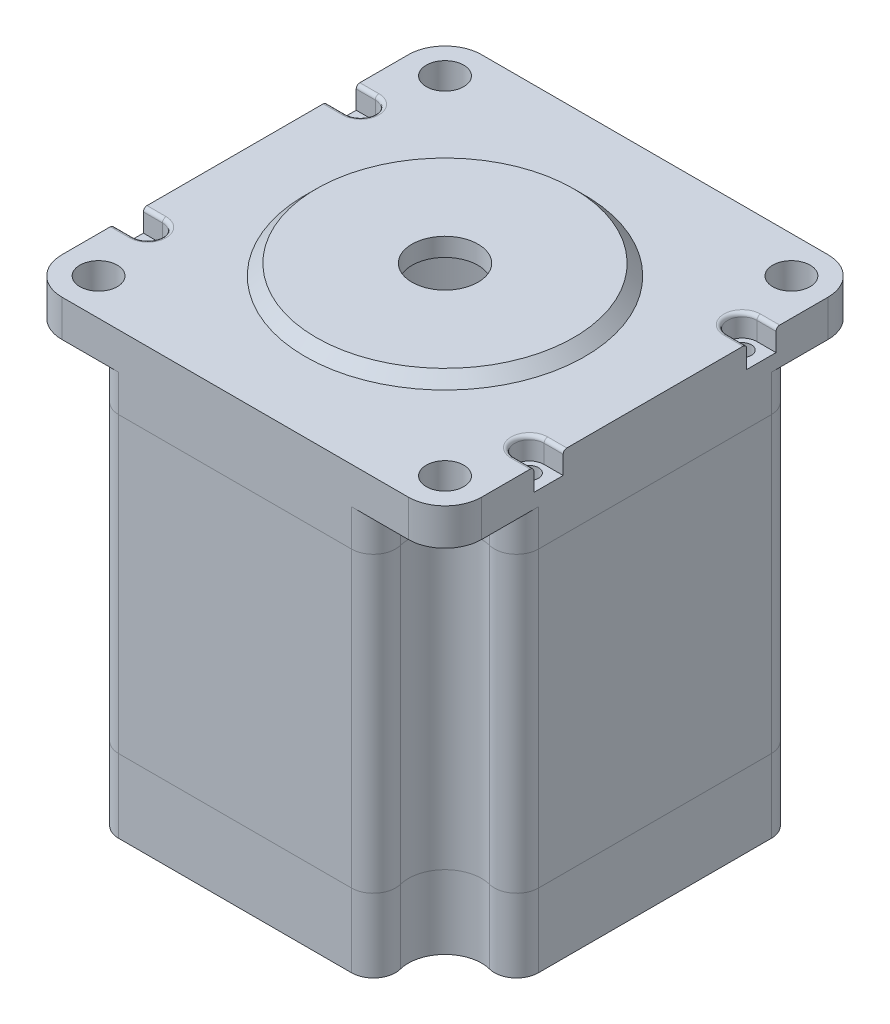
from build123d import *

# Parameters (mm, degrees)
BOSS_EXTRUDE1_DEPTH      = 30
SPLIT1_SURFACE_1_1_BACK  = 101.716
SPLIT1_SURFACE_1_1_DEPTH = 203.432
SPLIT1_SURFACE_1_2_BACK  = 101.716
SPLIT1_SURFACE_1_2_DEPTH = 203.432
SPLIT1_SURFACE_2_3_BACK  = 101.716
SPLIT1_SURFACE_2_3_DEPTH = 203.432
SPLIT1_SURFACE_2_4_BACK  = 101.716
SPLIT1_SURFACE_2_4_DEPTH = 203.432
SKETCH4_R                = 19.05
BOSS_EXTRUDE2_DEPTH      = 1.5
CHAMFER1_SIZE            = 1.5
SKETCH5_R                = 4.5
CUT_EXTRUDE1_DEPTH       = 74.60821964971032
FILLET1_R                = 1.5
CUT_EXTRUDE2_DEPTH       = 55
FILLET2_R                = 3
FILLET3_START            = 19
FILLET3_DEPTH            = 6
FILLET4_R                = 3
MIRROR1_START            = 20
MIRROR1_DEPTH            = 5
MIRROR1_START_2          = -20
MIRROR1_2_DEPTH          = 40
MIRROR1_START_3          = -30
MIRROR1_3_DEPTH          = 10
MIRROR2_START            = 20
MIRROR2_DEPTH            = 5
MIRROR2_START_2          = -20
MIRROR2_2_DEPTH          = 40
MIRROR2_START_3          = -30
MIRROR2_3_DEPTH          = 10
SKETCH7_R                = 2.5499999999999994
CUT_EXTRUDE3_DEPTH       = 73.35965743036655
FILLET5_R                = 5
SKETCH11_R               = 19.05
CUT_EXTRUDE4_DEPTH       = 29
CUT_EXTRUDE6_DEPTH       = 3
FILLET6_R                = 0.5
SKETCH16_R               = 1.2500000000000013
CUT_EXTRUDE8_DEPTH       = 73.35965743036655
CUT_EXTRUDE9_DEPTH       = 5


with BuildPart() as part:
    # Sketch1 → Boss-Extrude1 (new, symmetric)
    with BuildSketch(Plane(origin=(0, 0, 0), x_dir=(1, 0, 0), z_dir=(0, 1, 0))):
        Polygon((28.6, -28.600000000000005), (-28.6, -28.600000000000012), (-28.6, 28.59999999999999), (28.6, 28.599999999999998), align=None)
    extrude(amount=BOSS_EXTRUDE1_DEPTH, both=True)


with BuildPart() as body_2:
    # Split1: the piece behind the surface
    add(part.part)
    # Split1 surface 1: a surface, the sketch's curves swept straight by 203.432 mm
    with BuildLine(Plane(origin=(-3.47e-15, 0, -28.599999999999994), x_dir=(-1, 0, 1.2e-16), z_dir=(-1.2e-16, 0, -1)).offset(-SPLIT1_SURFACE_1_1_BACK), mode=Mode.PRIVATE) as split1_surface_1_1_path:
        Line((-28.600000000000005, 19.999999999999996), (28.599999999999998, 19.999999999999996))
    split1_surface_1_1 = Shell.extrude(split1_surface_1_1_path.wire(), (-1.2e-16 * SPLIT1_SURFACE_1_1_DEPTH, 0 * SPLIT1_SURFACE_1_1_DEPTH, -1 * SPLIT1_SURFACE_1_1_DEPTH))
    split(bisect_by=split1_surface_1_1, keep=Keep.BOTTOM)


with BuildPart() as part_1:
    add(part.part)

    # Split1: split by a surface, the side it looks to stays
    # Split1 surface 1: a surface, the sketch's curves swept straight by 203.432 mm
    with BuildLine(Plane(origin=(-3.47e-15, 0, -28.599999999999994), x_dir=(-1, 0, 1.2e-16), z_dir=(-1.2e-16, 0, -1)).offset(-SPLIT1_SURFACE_1_2_BACK), mode=Mode.PRIVATE) as split1_surface_1_2_path:
        Line((-28.600000000000005, 19.999999999999996), (28.599999999999998, 19.999999999999996))
    split1_surface_1_2 = Shell.extrude(split1_surface_1_2_path.wire(), (-1.2e-16 * SPLIT1_SURFACE_1_2_DEPTH, 0 * SPLIT1_SURFACE_1_2_DEPTH, -1 * SPLIT1_SURFACE_1_2_DEPTH))
    split(bisect_by=split1_surface_1_2, keep=Keep.TOP)

    # Sketch4 → Boss-Extrude2 (add)
    with BuildSketch(Plane(origin=(0, 30, 0), x_dir=(1, 0, 0), z_dir=(0, 1, 0))):
        with Locations(Location((0, 0, 0), (0, 0, 270))):
            Circle(SKETCH4_R)
    extrude(amount=BOSS_EXTRUDE2_DEPTH)

    # Chamfer1
    chamfer1_edges = [part_1.edges().sort_by_distance(p)[0] for p in [
        (5.83e-15, 31.5, -19.05),
    ]]
    chamfer(chamfer1_edges, length=CHAMFER1_SIZE - 0.0001)  # a hair under: the kernel refuses the full size


with BuildPart() as body_3:
    # Split1 2 body 2: the piece behind the surface
    add(body_2.part)
    # Split1 surface 2: a surface, the sketch's curves swept straight by 203.432 mm
    with BuildLine(Plane(origin=(-3.47e-15, 0, -28.599999999999994), x_dir=(-1, 0, 1.2e-16), z_dir=(-1.2e-16, 0, -1)).offset(-SPLIT1_SURFACE_2_3_BACK), mode=Mode.PRIVATE) as split1_surface_2_3_path:
        Line((-28.600000000000005, -19.999999999999996), (28.599999999999998, -19.999999999999996))
    split1_surface_2_3 = Shell.extrude(split1_surface_2_3_path.wire(), (-1.2e-16 * SPLIT1_SURFACE_2_3_DEPTH, 0 * SPLIT1_SURFACE_2_3_DEPTH, -1 * SPLIT1_SURFACE_2_3_DEPTH))
    split(bisect_by=split1_surface_2_3, keep=Keep.BOTTOM)


with BuildPart() as body_2_1:
    add(body_2.part)

    # Split1 2 body 2: split by a surface, the side it looks to stays
    # Split1 surface 2: a surface, the sketch's curves swept straight by 203.432 mm
    with BuildLine(Plane(origin=(-3.47e-15, 0, -28.599999999999994), x_dir=(-1, 0, 1.2e-16), z_dir=(-1.2e-16, 0, -1)).offset(-SPLIT1_SURFACE_2_4_BACK), mode=Mode.PRIVATE) as split1_surface_2_4_path:
        Line((-28.600000000000005, -19.999999999999996), (28.599999999999998, -19.999999999999996))
    split1_surface_2_4 = Shell.extrude(split1_surface_2_4_path.wire(), (-1.2e-16 * SPLIT1_SURFACE_2_4_DEPTH, 0 * SPLIT1_SURFACE_2_4_DEPTH, -1 * SPLIT1_SURFACE_2_4_DEPTH))
    split(bisect_by=split1_surface_2_4, keep=Keep.TOP)


with BuildPart() as cut_extrude1_tool:
    # Sketch5 → Cut-Extrude1 (new, through all)
    with BuildSketch(Plane(origin=(0, 31.5, 0), x_dir=(1, 0, 0), z_dir=(0, 1, 0))):
        with Locations(Location((0, 0, 0), (0, 0, 270))):
            Circle(SKETCH5_R)
    extrude(amount=-CUT_EXTRUDE1_DEPTH)


with BuildPart() as part_2:
    add(part_1.part)

    # Cut-Extrude1: cut by cut_extrude1_tool
    add(cut_extrude1_tool.part, mode=Mode.SUBTRACT)


with BuildPart() as body_2_2:
    add(body_2_1.part)

    # Cut-Extrude1: cut by cut_extrude1_tool
    add(cut_extrude1_tool.part, mode=Mode.SUBTRACT)


with BuildPart() as body_3_1:
    add(body_3.part)

    # Cut-Extrude1: cut by cut_extrude1_tool
    add(cut_extrude1_tool.part, mode=Mode.SUBTRACT)

    # Fillet1
    fillet1_edges = [body_3_1.edges().sort_by_distance(p)[0] for p in [
        (1.38e-15, -30, -4.5),
    ]]
    fillet(fillet1_edges, radius=FILLET1_R)


with BuildPart() as cut_extrude2_tool:
    # Sketch6 → Cut-Extrude2 (new body)
    with BuildSketch(Plane.XZ.offset(30)):
        with BuildLine():
            ThreePointArc((28.6, -23.599999999999994), (20.064466094067267, -20.064466094067242), (23.599999999999998, -28.599999999999984))
            Line((23.6, -28.599999999999998), (28.6, -28.599999999999998))
            Line((28.6, -28.599999999999998), (28.6, -23.599999999999994))
        make_face()
    extrude(amount=-CUT_EXTRUDE2_DEPTH)


with BuildPart() as part_3:
    add(part_2.part)

    # Cut-Extrude2: cut by cut_extrude2_tool
    add(cut_extrude2_tool.part, mode=Mode.SUBTRACT)

    # Fillet3: read off the stored shape, not the designer's step
    # Fillet3 outline → Fillet3 (cut)
    with BuildSketch(Plane(origin=(0, 0, 0), x_dir=(1, 0, 0), z_dir=(0, 1, 0)).offset(FILLET3_START)):
        with BuildLine():
            ThreePointArc((28.6, 23.6), (27.552847075, 20.538137821), (24.85, 18.758770817))
            ThreePointArc((24.85, 18.758770817), (27.437117307, 18.225741553), (28.6, 15.854033308))
            Line((28.6, 15.854033308), (28.6, 23.6))
        make_face()
        with BuildLine():
            ThreePointArc((15.854033308, 28.6), (18.225741553, 27.437117307), (18.758770817, 24.85))
            ThreePointArc((18.758770817, 24.85), (20.538137821, 27.552847075), (23.6, 28.6))
            Line((23.6, 28.6), (15.854033308, 28.6))
        make_face()
    extrude(amount=FILLET3_DEPTH, mode=Mode.SUBTRACT)

    # Mirror1: read off the stored shape, not the designer's step
    # Mirror1 outline → Mirror1 (cut)
    with BuildSketch(Plane(origin=(0, 0, 0), x_dir=(1, 0, 0), z_dir=(0, 1, 0)).offset(MIRROR1_START)):
        with BuildLine():
            Line((-28.6, 28.6), (-28.6, 15.854033308))
            ThreePointArc((-28.6, 15.854033308), (-27.437117307, 18.225741553), (-24.85, 18.758770817))
            ThreePointArc((-24.85, 18.758770817), (-20.064466094, 20.064466094), (-18.758770817, 24.85))
            ThreePointArc((-18.758770817, 24.85), (-18.225741553, 27.437117307), (-15.854033308, 28.6))
            Line((-15.854033308, 28.6), (-28.6, 28.6))
        make_face()
    extrude(amount=MIRROR1_DEPTH, mode=Mode.SUBTRACT)

    # Mirror2: read off the stored shape, not the designer's step
    # Mirror2 outline → Mirror2 (cut)
    with BuildSketch(Plane(origin=(0, 0, 0), x_dir=(1, 0, 0), z_dir=(0, 1, 0)).offset(MIRROR2_START)):
        with BuildLine():
            ThreePointArc((-18.758770817, -24.85), (-20.064466094, -20.064466094), (-24.85, -18.758770817))
            ThreePointArc((-24.85, -18.758770817), (-27.437117307, -18.225741553), (-28.6, -15.854033308))
            Line((-28.6, -15.854033308), (-28.6, -28.6))
            Line((-28.6, -28.6), (-15.854033308, -28.6))
            ThreePointArc((-15.854033308, -28.6), (-18.225741553, -27.437117307), (-18.758770817, -24.85))
        make_face()
        with BuildLine():
            ThreePointArc((18.758770817, -24.85), (18.225741553, -27.437117307), (15.854033308, -28.6))
            Line((15.854033308, -28.6), (28.6, -28.6))
            Line((28.6, -28.6), (28.6, -15.854033308))
            ThreePointArc((28.6, -15.854033308), (27.437117307, -18.225741553), (24.85, -18.758770817))
            ThreePointArc((24.85, -18.758770817), (20.064466094, -20.064466094), (18.758770817, -24.85))
        make_face()
    extrude(amount=MIRROR2_DEPTH, mode=Mode.SUBTRACT)

    # Sketch7 → Cut-Extrude3 (cut, through all)
    with BuildSketch(Plane(origin=(0, 30, 0), x_dir=(1, 0, 0), z_dir=(0, 1, 0))):
        with Locations(Location((-23.6, 23.6, 0), (0, 0, 270))):
            Circle(SKETCH7_R)
        with Locations(Location((23.6, 23.6, 0), (0, 0, 270))):
            Circle(SKETCH7_R)
        with Locations(Location((23.6, -23.60000000000001, 0), (0, 0, 270))):
            Circle(SKETCH7_R)
        with Locations(Location((-23.60000000000001, -23.599999999999994, 0), (0, 0, 270))):
            Circle(SKETCH7_R)
    extrude(amount=-CUT_EXTRUDE3_DEPTH, mode=Mode.SUBTRACT)

    # Fillet5
    fillet5_edges = [part_3.edges().sort_by_distance(p)[0] for p in [
        (-28.6, 27.5, -28.59999999999999),
        (28.6, 27.5, -28.599999999999998),
        (28.6, 27.5, 28.600000000000005),
        (-28.6, 27.5, 28.600000000000012),
    ]]
    fillet(fillet5_edges, radius=FILLET5_R)


with BuildPart() as body_2_3:
    add(body_2_2.part)

    # Cut-Extrude2: cut by cut_extrude2_tool
    add(cut_extrude2_tool.part, mode=Mode.SUBTRACT)

    # Fillet2
    fillet2_edges = [body_2_3.edges().sort_by_distance(p)[0] for p in [
        (23.6, 3.55e-15, -28.59999999999999),
    ]]
    fillet(fillet2_edges, radius=FILLET2_R)
    fillet2_2_edges = [body_2_3.edges().sort_by_distance(p)[0] for p in [
        (28.6, 3.55e-15, -23.599999999999994),
    ]]
    fillet(fillet2_2_edges, radius=FILLET2_R)

    # Mirror1 2 outline → Mirror1 2 (cut)
    with BuildSketch(Plane(origin=(0, 0, 0), x_dir=(1, 0, 0), z_dir=(0, 1, 0)).offset(MIRROR1_START_2)):
        with BuildLine():
            Line((-28.6, 28.6), (-28.6, 15.854033308))
            ThreePointArc((-28.6, 15.854033308), (-27.437117307, 18.225741553), (-24.85, 18.758770817))
            ThreePointArc((-24.85, 18.758770817), (-20.064466094, 20.064466094), (-18.758770817, 24.85))
            ThreePointArc((-18.758770817, 24.85), (-18.225741553, 27.437117307), (-15.854033308, 28.6))
            Line((-15.854033308, 28.6), (-28.6, 28.6))
        make_face()
    extrude(amount=MIRROR1_2_DEPTH, mode=Mode.SUBTRACT)

    # Mirror2 2 outline → Mirror2 2 (cut)
    with BuildSketch(Plane(origin=(0, 0, 0), x_dir=(1, 0, 0), z_dir=(0, 1, 0)).offset(MIRROR2_START_2)):
        with BuildLine():
            ThreePointArc((-18.758770817, -24.85), (-20.064466094, -20.064466094), (-24.85, -18.758770817))
            ThreePointArc((-24.85, -18.758770817), (-27.437117307, -18.225741553), (-28.6, -15.854033308))
            Line((-28.6, -15.854033308), (-28.6, -28.6))
            Line((-28.6, -28.6), (-15.854033308, -28.6))
            ThreePointArc((-15.854033308, -28.6), (-18.225741553, -27.437117307), (-18.758770817, -24.85))
        make_face()
        with BuildLine():
            ThreePointArc((18.758770817, -24.85), (18.225741553, -27.437117307), (15.854033308, -28.6))
            Line((15.854033308, -28.6), (28.6, -28.6))
            Line((28.6, -28.6), (28.6, -15.854033308))
            ThreePointArc((28.6, -15.854033308), (27.437117307, -18.225741553), (24.85, -18.758770817))
            ThreePointArc((24.85, -18.758770817), (20.064466094, -20.064466094), (18.758770817, -24.85))
        make_face()
    extrude(amount=MIRROR2_2_DEPTH, mode=Mode.SUBTRACT)


with BuildPart() as body_3_2:
    add(body_3_1.part)

    # Cut-Extrude2: cut by cut_extrude2_tool
    add(cut_extrude2_tool.part, mode=Mode.SUBTRACT)

    # Fillet4
    fillet4_edges = [body_3_2.edges().sort_by_distance(p)[0] for p in [
        (23.6, -25, -28.59999999999999),
    ]]
    fillet(fillet4_edges, radius=FILLET4_R)
    fillet4_2_edges = [body_3_2.edges().sort_by_distance(p)[0] for p in [
        (28.6, -25, -23.599999999999994),
    ]]
    fillet(fillet4_2_edges, radius=FILLET4_R)

    # Mirror1 3 outline → Mirror1 3 (cut)
    with BuildSketch(Plane(origin=(0, 0, 0), x_dir=(1, 0, 0), z_dir=(0, 1, 0)).offset(MIRROR1_START_3)):
        with BuildLine():
            Line((-28.6, 28.6), (-28.6, 15.854033308))
            ThreePointArc((-28.6, 15.854033308), (-27.437117307, 18.225741553), (-24.85, 18.758770817))
            ThreePointArc((-24.85, 18.758770817), (-20.064466094, 20.064466094), (-18.758770817, 24.85))
            ThreePointArc((-18.758770817, 24.85), (-18.225741553, 27.437117307), (-15.854033308, 28.6))
            Line((-15.854033308, 28.6), (-28.6, 28.6))
        make_face()
    extrude(amount=MIRROR1_3_DEPTH, mode=Mode.SUBTRACT)

    # Mirror2 3 outline → Mirror2 3 (cut)
    with BuildSketch(Plane(origin=(0, 0, 0), x_dir=(1, 0, 0), z_dir=(0, 1, 0)).offset(MIRROR2_START_3)):
        with BuildLine():
            ThreePointArc((-18.758770817, -24.85), (-20.064466094, -20.064466094), (-24.85, -18.758770817))
            ThreePointArc((-24.85, -18.758770817), (-27.437117307, -18.225741553), (-28.6, -15.854033308))
            Line((-28.6, -15.854033308), (-28.6, -28.6))
            Line((-28.6, -28.6), (-15.854033308, -28.6))
            ThreePointArc((-15.854033308, -28.6), (-18.225741553, -27.437117307), (-18.758770817, -24.85))
        make_face()
        with BuildLine():
            ThreePointArc((18.758770817, -24.85), (18.225741553, -27.437117307), (15.854033308, -28.6))
            Line((15.854033308, -28.6), (28.6, -28.6))
            Line((28.6, -28.6), (28.6, -15.854033308))
            ThreePointArc((28.6, -15.854033308), (27.437117307, -18.225741553), (24.85, -18.758770817))
            ThreePointArc((24.85, -18.758770817), (20.064466094, -20.064466094), (18.758770817, -24.85))
        make_face()
    extrude(amount=MIRROR2_3_DEPTH, mode=Mode.SUBTRACT)


with BuildPart() as cut_extrude4_tool:
    # Sketch11 → Cut-Extrude4 (new, symmetric)
    with BuildSketch(Plane(origin=(0, 0, 0), x_dir=(1, 0, 0), z_dir=(0, 1, 0))):
        with Locations(Location((0, 0, 0), (0, 0, 270))):
            Circle(SKETCH11_R)
    extrude(amount=CUT_EXTRUDE4_DEPTH, both=True)


with BuildPart() as part_4:
    add(part_3.part)

    # Cut-Extrude4: cut by cut_extrude4_tool
    add(cut_extrude4_tool.part, mode=Mode.SUBTRACT)

    # Sketch15 → Cut-Extrude6 (cut)
    with BuildSketch(Plane(origin=(0, 30, 0), x_dir=(1, 0, 0), z_dir=(0, 1, 0))):
        with BuildLine():
            ThreePointArc((-25.999999999999996, 12.499999999999996), (-23.999999999999996, 14.499999999999996), (-25.999999999999996, 16.499999999999996))
            Line((-25.999999999999996, 16.499999999999996), (-28.6, 16.499999999999993))
            Line((-28.6, 16.499999999999993), (-28.6, 12.499999999999991))
            Line((-28.6, 12.499999999999991), (-25.999999999999996, 12.499999999999996))
        make_face()
        with BuildLine():
            Line((-25.999999999999993, -12.50000000000001), (-28.599999999999998, -12.500000000000004))
            Line((-28.599999999999998, -12.500000000000004), (-28.599999999999998, -16.500000000000007))
            Line((-28.599999999999998, -16.500000000000007), (-25.999999999999993, -16.50000000000001))
            ThreePointArc((-25.999999999999993, -16.50000000000001), (-24.000000000000007, -14.50000000000001), (-25.999999999999993, -12.500000000000009))
        make_face()
        with BuildLine():
            Line((28.600000000000023, -16.49999999999994), (28.600000000000023, -12.499999999999934))
            Line((28.600000000000023, -12.499999999999934), (26.000000000000018, -12.499999999999948))
            ThreePointArc((26.000000000000018, -12.499999999999948), (23.999999999999957, -14.499999999999948), (26.000000000000018, -16.49999999999995))
            Line((26.000000000000018, -16.49999999999995), (28.600000000000023, -16.49999999999994))
        make_face()
        with BuildLine():
            Line((26.000000000000018, 12.499999999999948), (28.600000000000023, 12.499999999999934))
            Line((28.600000000000023, 12.499999999999934), (28.600000000000023, 16.49999999999994))
            Line((28.600000000000023, 16.49999999999994), (26.000000000000018, 16.49999999999995))
            ThreePointArc((26.000000000000018, 16.49999999999995), (23.99999999999995, 14.499999999999948), (26.000000000000018, 12.499999999999947))
        make_face()
    extrude(amount=-CUT_EXTRUDE6_DEPTH, mode=Mode.SUBTRACT)

    # Fillet6
    fillet6_edges = [part_4.edges().sort_by_distance(p)[0] for p in [
        (23.99999999999995, 30, -14.499999999999948),
        (27.30000000000002, 30, -16.499999999999947),
        (27.30000000000002, 30, -12.499999999999941),
        (27.30000000000002, 30, 12.499999999999941),
        (23.999999999999957, 30, 14.49999999999995),
        (27.30000000000002, 30, 16.499999999999943),
        (-24.000000000000007, 30, 14.50000000000001),
        (-27.299999999999997, 30, 16.500000000000007),
        (-27.299999999999997, 30, 12.500000000000007),
        (-27.299999999999997, 30, -12.499999999999995),
        (-23.999999999999996, 30, -14.499999999999996),
        (-27.299999999999997, 30, -16.499999999999993),
    ]]
    fillet(fillet6_edges, radius=FILLET6_R)


with BuildPart() as body_2_4:
    add(body_2_3.part)

    # Cut-Extrude4: cut by cut_extrude4_tool
    add(cut_extrude4_tool.part, mode=Mode.SUBTRACT)


with BuildPart() as body_3_3:
    add(body_3_2.part)

    # Cut-Extrude4: cut by cut_extrude4_tool
    add(cut_extrude4_tool.part, mode=Mode.SUBTRACT)


with BuildPart() as cut_extrude8_tool:
    # Sketch16 → Cut-Extrude8 (new, through all)
    with BuildSketch(Plane(origin=(0, 30, 0), x_dir=(1, 0, 0), z_dir=(0, 1, 0))):
        with Locations(Location((-25.999999999999996, -14.500000000000004, 0), (0, 0, 270))):
            Circle(SKETCH16_R)
        with Locations(Location((-25.999999999999996, 14.499999999999996, 0), (0, 0, 270))):
            Circle(SKETCH16_R)
        with Locations(Location((26.000000000000004, 14.500000000000004, 0), (0, 0, 270))):
            Circle(SKETCH16_R)
        with Locations(Location((26.000000000000004, -14.499999999999996, 0), (0, 0, 270))):
            Circle(SKETCH16_R)
    extrude(amount=-CUT_EXTRUDE8_DEPTH)


with BuildPart() as part_5:
    add(part_4.part)

    # Cut-Extrude8: cut by cut_extrude8_tool
    add(cut_extrude8_tool.part, mode=Mode.SUBTRACT)


with BuildPart() as body_2_5:
    add(body_2_4.part)

    # Cut-Extrude8: cut by cut_extrude8_tool
    add(cut_extrude8_tool.part, mode=Mode.SUBTRACT)


with BuildPart() as body_3_4:
    add(body_3_3.part)

    # Cut-Extrude8: cut by cut_extrude8_tool
    add(cut_extrude8_tool.part, mode=Mode.SUBTRACT)

    # Sketch17 → Cut-Extrude9 (cut)
    with BuildSketch(Plane(origin=(-3.47e-15, 0, -28.599999999999994), x_dir=(-1, 0, 1.2e-16), z_dir=(-1.2e-16, 0, -1))):
        Polygon((-12.499999999999998, -19.999999999999993), (12.499999999999998, -19.999999999999993), (12.5, -26.99999999999999), (-12.5, -26.999999999999993), align=None)
    extrude(amount=-CUT_EXTRUDE9_DEPTH, mode=Mode.SUBTRACT)


solid = Compound([part_5.part, body_2_5.part, body_3_4.part])
